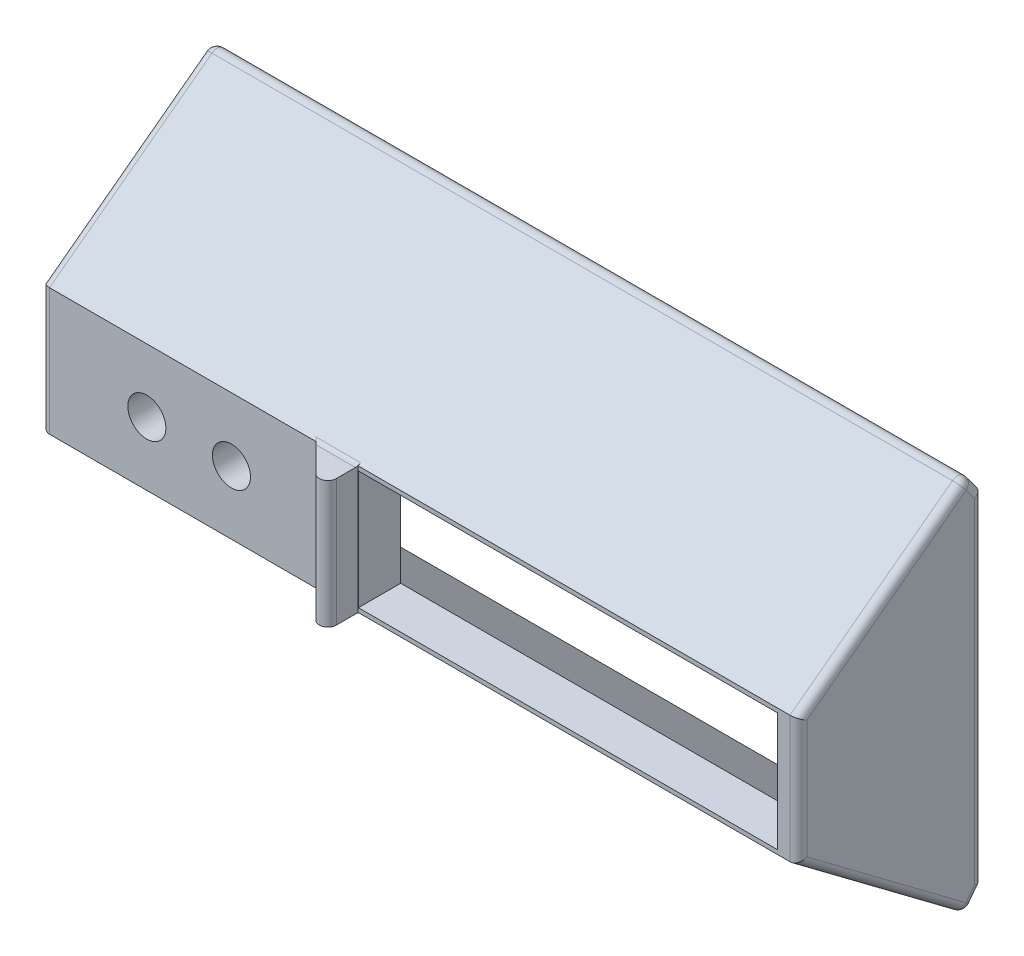
from build123d import *

# Parameters (mm, degrees)
BOSS_EXTRUDE1_DEPTH = 80
SKETCH2_R           = 2.250000000000002
SKETCH2_R_2         = 2.249999999999999
CUT_EXTRUDE1_DEPTH  = 86.91559811815314
SKETCH3_W           = 8.000000000000007
SKETCH3_H           = 15.000000000000002
BOSS_EXTRUDE2_DEPTH = 5
CHAMFER1_SIZE       = 8
FILLET1_R           = 1
BOSS_EXTRUDE3_DEPTH = 7
BOSS_EXTRUDE4_START = 2.5
BOSS_EXTRUDE4_DEPTH = 2.5
FILLET3_R           = 1


with BuildPart() as part:
    # Sketch1 → Boss-Extrude1 (new body)
    with BuildSketch(Plane.YZ):
        Polygon((-22.5, -17.5), (-7.500000000000001, 2.5000000000000004), (-7.499999999999999, -2.4999999999999996), (-20.099999999999994, -19.300000000000004), align=None)
        Polygon((7.500000000000001, 2.5000000000000004), (7.500000000000001, -2.4999999999999996), (-7.499999999999999, -2.4999999999999996), (-7.500000000000001, 2.5000000000000004), align=None)
        Polygon((7.500000000000001, 2.5000000000000004), (7.500000000000001, -2.4999999999999996), (20.099999999999994, -19.300000000000004), (22.5, -17.5), align=None)
    extrude(amount=BOSS_EXTRUDE1_DEPTH)

    # Sketch2 → Cut-Extrude1 (cut, through all)
    with BuildSketch(Plane.XY.offset(2.5000000000000004)):
        with Locations((5.5, 0)):
            Circle(SKETCH2_R)
        with Locations((15.5, 0)):
            Circle(SKETCH2_R_2)
        Polygon((80, 7.0000000000000036), (30.5, 6.999999999999997), (30.5, -7.000000000000003), (80, -6.9999999999999964), align=None)
    extrude(amount=-CUT_EXTRUDE1_DEPTH, mode=Mode.SUBTRACT)

    # Sketch3 → Boss-Extrude2 (add)
    with BuildSketch(Plane.XY.offset(2.5000000000000004)):
        with Locations((26.47757310370073, 0)):
            Rectangle(SKETCH3_W, SKETCH3_H)
    extrude(amount=BOSS_EXTRUDE2_DEPTH)

    # Chamfer1
    # the kernel refuses this chamfer: 8 mm, written as the material it takes off along each edge
    with BuildSketch(Plane(origin=(22.477573103700728, 28.073463903727287, 7.5), x_dir=(-0.027495876610586494, 0, -0.9996219169112968), z_dir=(0, -1, 0))) as chamfer1_piece_1_section:
        Polygon((CHAMFER1_SIZE * 0.999621916911, CHAMFER1_SIZE * 0.0274958766106), (-CHAMFER1_SIZE * 0.0274958766106, CHAMFER1_SIZE * 0.999621916911), (0, 0), align=None)
    chamfer1_piece_1 = extrude(amount=56.146927807454574, mode=Mode.PRIVATE)
    chamfer1_piece_1 = split(chamfer1_piece_1, bisect_by=Plane(origin=(25.44368954303125, 0, 2.5000000000000004), z_dir=(0, 0, 1)), keep=Keep.TOP, mode=Mode.PRIVATE)
    add(chamfer1_piece_1, mode=Mode.SUBTRACT)

    # Fillet1
    fillet1_edges = [part.edges().sort_by_distance(p)[0] for p in [
        (40, -7.499999999999999, -2.4999999999999996),
        (40, 7.500000000000001, -2.4999999999999996),
        (27.977573103699285, 7.500000000000001, 2.5000000000000004),
        (27.977573103699285, -7.500000000000001, 2.5000000000000004),
        (30.47757310370073, 0, 7.5),
    ]]
    fillet(fillet1_edges, radius=FILLET1_R)

    # Sketch4 → Boss-Extrude3 (add)
    with BuildSketch(Plane(origin=(0, 0, 0), x_dir=(0, -1, 0), z_dir=(-1, 0, 0))):
        with BuildLine():
            Line((22.5, -17.5), (7.500000000000001, 2.5000000000000004))
            Line((7.500000000000001, 2.5000000000000004), (-7.500000000000001, 2.5000000000000004))
            Line((-7.500000000000001, 2.5000000000000004), (-22.5, -17.5))
            Line((-22.5, -17.5), (-20.099999999999994, -19.300000000000004))
            Line((-20.099999999999994, -19.300000000000004), (-7.800000000000002, -2.9000000000000004))
            ThreePointArc((-7.800000000000002, -2.9000000000000004), (-7.447213595499958, -2.6055728090000834), (-6.999999999999999, -2.4999999999999987))
            Line((-6.999999999999999, -2.4999999999999987), (6.999999999999998, -2.4999999999999996))
            ThreePointArc((6.999999999999998, -2.4999999999999996), (7.4472135954999565, -2.6055728090000834), (7.799999999999999, -2.8999999999999995))
            Line((7.799999999999999, -2.8999999999999995), (20.099999999999998, -19.300000000000008))
            Line((20.099999999999998, -19.300000000000008), (22.5, -17.5))
        make_face()
    extrude(amount=BOSS_EXTRUDE3_DEPTH)

    # Sketch6 → Boss-Extrude4 (add)
    with BuildSketch(Plane.YZ.offset(80).offset(BOSS_EXTRUDE4_START)):
        with BuildLine():
            Line((-6.9999999999999964, -2.4999999999999987), (-6.9999999999999964, 2.5000000000000004))
            Line((-6.9999999999999964, 2.5000000000000004), (7.0000000000000036, 2.5000000000000004))
            Line((7.0000000000000036, 2.5000000000000004), (7.0000000000000036, -2.4999999999999996))
            ThreePointArc((7.0000000000000036, -2.4999999999999996), (7.44721359549996, -2.605572809000085), (7.800000000000002, -2.9000000000000004))
            Line((7.800000000000002, -2.9000000000000004), (20.099999999999994, -19.300000000000004))
            Line((20.099999999999994, -19.300000000000004), (-20.099999999999998, -19.300000000000008))
            Line((-20.099999999999998, -19.300000000000008), (-7.799999999999999, -2.8999999999999995))
            ThreePointArc((-7.799999999999999, -2.8999999999999995), (-7.447213595499956, -2.6055728090000825), (-6.9999999999999964, -2.4999999999999987))
        make_face()
        with BuildLine():
            ThreePointArc((-6.9999999999999964, -2.4999999999999987), (-7.447213595499956, -2.6055728090000825), (-7.799999999999999, -2.8999999999999995))
            Line((-7.799999999999999, -2.8999999999999995), (-20.099999999999998, -19.300000000000008))
            Line((-20.099999999999998, -19.300000000000008), (-22.5, -17.5))
            Line((-22.5, -17.5), (-7.500000000000001, 2.5000000000000004))
            Line((-7.500000000000001, 2.5000000000000004), (-6.9999999999999964, 2.5000000000000004))
            Line((-6.9999999999999964, 2.5000000000000004), (-6.9999999999999964, -2.4999999999999987))
        make_face()
        with BuildLine():
            Line((7.500000000000001, 2.5000000000000004), (7.0000000000000036, 2.5000000000000004))
            Line((7.0000000000000036, 2.5000000000000004), (7.0000000000000036, -2.4999999999999996))
            ThreePointArc((7.0000000000000036, -2.4999999999999996), (7.44721359549996, -2.605572809000085), (7.800000000000002, -2.9000000000000004))
            Line((7.800000000000002, -2.9000000000000004), (20.099999999999994, -19.300000000000004))
            Line((20.099999999999994, -19.300000000000004), (22.5, -17.5))
            Line((22.5, -17.5), (7.500000000000001, 2.5000000000000004))
        make_face()
    extrude(amount=-BOSS_EXTRUDE4_DEPTH)

    # Fillet3
    fillet3_edges = [part.edges().sort_by_distance(p)[0] for p in [
        (-7, -21.299999999999997, -18.400000000000002),
        (-7, -15, -7.5),
        (-7, 0, 2.5000000000000004),
        (37.75, 22.5, -17.5),
        (-7, 15, -7.5),
        (-7, 21.299999999999997, -18.400000000000002),
        (-7, 13.949999999999998, -11.100000000000001),
        (-7, 7.447213595499958, -2.605572809000084),
        (-7, 8.9e-16, -2.499999999999999),
        (-7, -7.4472135954999565, -2.6055728090000834),
        (-7, -13.95, -11.100000000000005),
        (37.75, -22.5, -17.5),
        (82.5, 0, 2.5000000000000004),
        (82.5, -15, -7.5),
        (82.5, -21.299999999999997, -18.400000000000002),
        (82.5, 0, -19.300000000000004),
        (82.5, 21.299999999999997, -18.400000000000002),
        (82.5, 15, -7.5),
    ]]
    fillet(fillet3_edges, radius=FILLET3_R)


solid = part.part
